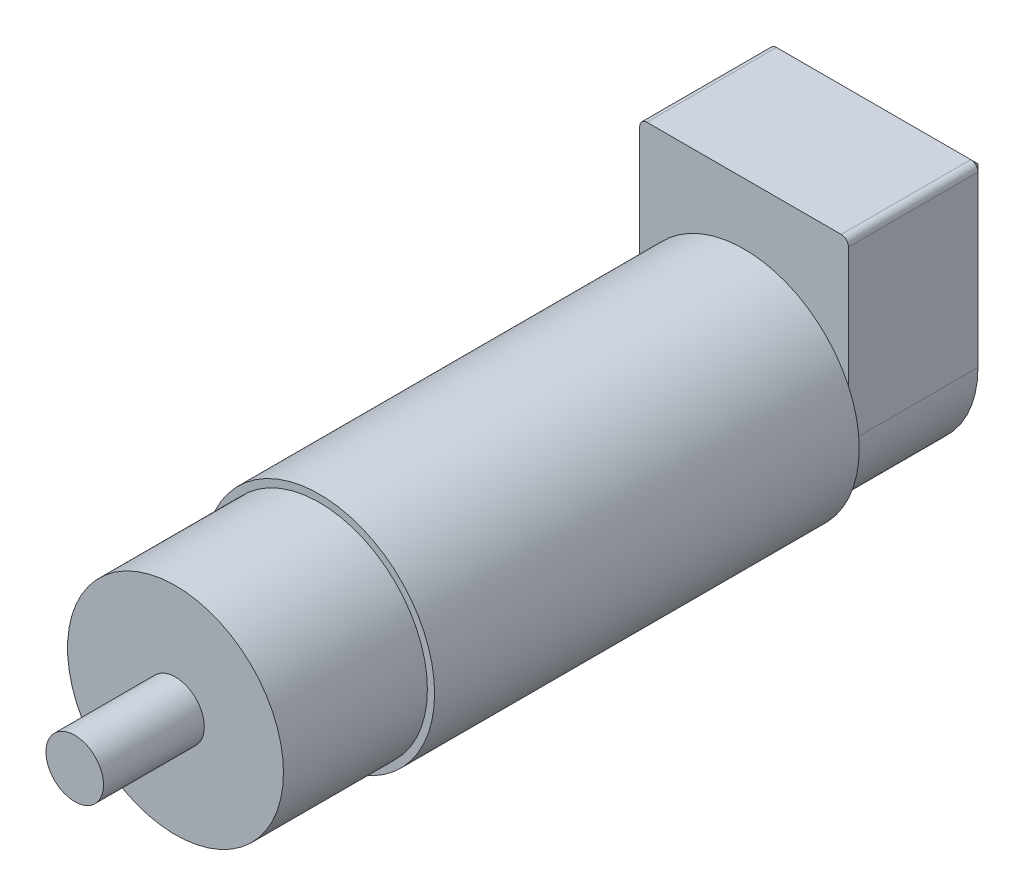
from build123d import *

# Parameters (mm, degrees)
SKETCH_1_R          = 16
EXTRUDE_1_DEPTH     = 79
SKETCH_2_R          = 4
EXTRUDE_2_DEPTH     = 14
CUT_EXTRUDE_START   = -20
SKETCH_3_R          = 16
SKETCH_3_R_2        = 15
CUT_EXTRUDE_1_DEPTH = 20
EXTRUDE_3_DEPTH     = 19
CHAMFER_1_SIZE      = 1


with BuildPart() as part:
    # 草圖1 → 填料-伸長1 (new body)
    with BuildSketch(Plane.XY):
        Circle(SKETCH_1_R)
    extrude(amount=EXTRUDE_1_DEPTH)

    # 草圖2 → 填料-伸長2 (add)
    with BuildSketch(Plane.XY.offset(79)):
        Circle(SKETCH_2_R)
    extrude(amount=EXTRUDE_2_DEPTH)

    # 草圖3 → 除料-伸長1 (cut)
    with BuildSketch(Plane.XY.offset(79).offset(CUT_EXTRUDE_START)):
        Circle(SKETCH_3_R)
        Circle(SKETCH_3_R_2, mode=Mode.SUBTRACT)
    extrude(amount=CUT_EXTRUDE_1_DEPTH, mode=Mode.SUBTRACT)

    # 草圖4 → 填料-伸長3 (add)
    with BuildSketch(Plane(origin=(0, 0, 0), x_dir=(-1, 0, 0), z_dir=(0, 0, -1))):
        with BuildLine():
            Line((14.5, 0), (14.5, 23.5))
            ThreePointArc((14.5, 23.5), (14.207106781, 24.207106781), (13.5, 24.5))
            Line((13.5, 24.5), (-13.5, 24.5))
            ThreePointArc((-13.5, 24.5), (-14.207106781, 24.207106781), (-14.5, 23.5))
            Line((-14.5, 23.5), (-14.5, 0))
            ThreePointArc((-14.5, 0), (0, -14.5), (14.5, 0))
        make_face()
    extrude(amount=EXTRUDE_3_DEPTH)

    # 導角1
    chamfer_1_edges = [part.edges().sort_by_distance(p)[0] for p in [
        (0, -14.5, -19),
        (-14.5, 11.75, -19),
        (-14.207106781, 24.207106781, -19),
        (0, 24.5, -19),
        (14.207106781, 24.207106781, -19),
        (14.5, 11.75, -19),
    ]]
    chamfer(chamfer_1_edges, length=CHAMFER_1_SIZE - 0.0001)  # a hair under: the kernel refuses the full size


solid = part.part
